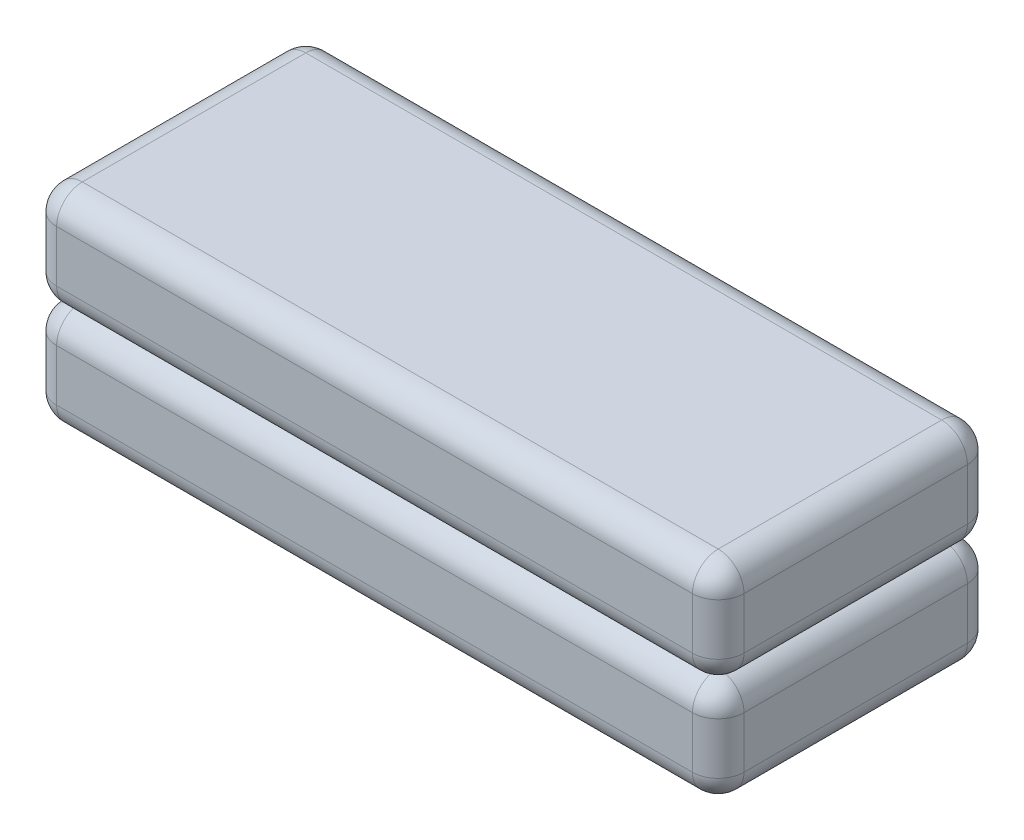
from build123d import *

# Parameters (mm, degrees)
SKETCH1_W           = 2000
SKETCH1_H           = 800
BOSS_EXTRUDE1_DEPTH = 300
FILLET1_R           = 75
SKETCH2_W           = 2000
SKETCH2_H           = 800
BOSS_EXTRUDE2_DEPTH = 300
FILLET4_R           = 75
SKETCH3_R           = 50
CUT_EXTRUDE1_DEPTH  = 5


with BuildPart() as part:
    # Sketch1 → Boss-Extrude1 (new body)
    with BuildSketch(Plane(origin=(0, 0, 0), x_dir=(1, 0, 0), z_dir=(0, 1, 0))):
        Rectangle(SKETCH1_W, SKETCH1_H)
    extrude(amount=BOSS_EXTRUDE1_DEPTH)

    # Fillet1
    fillet1_edges = [part.edges().sort_by_distance(p)[0] for p in [
        (1000, 300, 0),
        (0, 300, -400),
        (-1000, 300, 0),
        (0, 0, -400),
        (1000, 0, 0),
        (0, 0, 400),
        (-1000, 0, 0),
        (0, 300, 400),
        (-1000, 150, -400),
        (1000, 150, -400),
        (1000, 150, 400),
        (-1000, 150, 400),
    ]]
    fillet(fillet1_edges, radius=FILLET1_R)

    # Sketch2 → Boss-Extrude2 (add)
    with BuildSketch(Plane.XZ):
        Rectangle(SKETCH2_W, SKETCH2_H)
    extrude(amount=BOSS_EXTRUDE2_DEPTH)

    # Fillet4
    fillet4_edges = [part.edges().sort_by_distance(p)[0] for p in [
        (1000, 0, 0),
        (1000, -150, -400),
        (0, 0, 400),
        (1000, -150, 400),
        (-1000, 0, 0),
        (-1000, -150, 400),
        (0, 0, -400),
        (-1000, -150, -400),
        (1000, -300, 0),
        (0, -300, 400),
        (-1000, -300, 0),
        (0, -300, -400),
    ]]
    fillet(fillet4_edges, radius=FILLET4_R - 0.0001)  # a hair under: the kernel refuses the full size

    # Sketch3 → Cut-Extrude1 (cut)
    with BuildSketch(Plane.XZ.offset(300)):
        with Locations(Location((-775, 225, 0), (0, 0, 270))):
            Circle(SKETCH3_R)
        with Locations(Location((775, 225, 0), (0, 0, 90))):
            Circle(SKETCH3_R)
        with Locations(Location((775, -225, 0), (0, 0, 270))):
            Circle(SKETCH3_R)
        with Locations(Location((-775, -225, 0), (0, 0, 90))):
            Circle(SKETCH3_R)
    extrude(amount=-CUT_EXTRUDE1_DEPTH, mode=Mode.SUBTRACT)


solid = part.part
